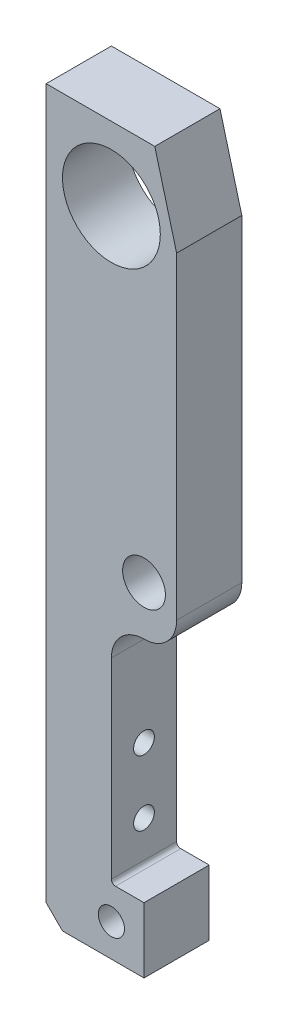
from build123d import *

# Parameters (mm, degrees)
SKETCH1_W                        = 25.4
SKETCH1_H                        = 141.2875
EXTRUDE1_DEPTH                   = 6.35
CUT_EXTRUDE1_REACH               = 74.891
SKETCH2_R                        = 9.525
CUT_EXTRUDE2_REACH               = 74.891
CHAMFER1_SIZE                    = 15.875
CHAMFER1_SIZE2                   = 4.25369343
F_21_64_0_32813_DIAMETER_HOLE1_D = 8.334502
F_1_4_20_TAPPED_HOLE1_D          = 5.1054
F_10_32_TAPPED_HOLE1_D           = 4.0386
F_10_32_TAPPED_HOLE1_DEPTH       = 13.716
F_10_32_TAPPED_HOLE1_TIP         = 1.213317848
FILLET1_R                        = 6.35
CHAMFER2_SIZE                    = 3.175


with BuildPart() as part:
    # Sketch1 → Extrude1 (new, symmetric)
    with BuildSketch(Plane.XY):
        Rectangle(SKETCH1_W, SKETCH1_H)
    extrude(amount=EXTRUDE1_DEPTH, both=True)

    # Sketch2 → Cut-Extrude1 (cut, up to next)
    with BuildSketch(Plane.XY.offset(6.35), mode=Mode.PRIVATE) as cut_extrude1_sk1:
        with Locations((0, 56.35625)):
            Circle(SKETCH2_R)
    cut_extrude1_tool1 = extrude(cut_extrude1_sk1.sketch, amount=-CUT_EXTRUDE1_REACH, mode=Mode.PRIVATE) & part.part
    add(cut_extrude1_tool1.solids().sort_by_distance((0, 56.35625, 6.35))[0], mode=Mode.SUBTRACT)

    # Sketch3 → Cut-Extrude2 (cut, up to next)
    with BuildSketch(Plane.XY.offset(6.35), mode=Mode.PRIVATE) as cut_extrude2_sk1:
        with BuildLine():
            Line((6.35, -57.94375), (0.79375, -57.94375))
            ThreePointArc((0.79375, -57.94375), (0.232483992, -57.711266008), (0, -57.15))
            Line((0, -57.15), (0, -19.84375))
            ThreePointArc((0, -19.84375), (1.859871939, -15.353621939), (6.35, -13.49375))
            Line((6.35, -13.49375), (12.7, -13.49375))
            Line((12.7, -13.49375), (12.7, -70.64375))
            Line((12.7, -70.64375), (6.35, -70.64375))
            Line((6.35, -70.64375), (6.35, -57.94375))
        make_face()
    cut_extrude2_tool1 = extrude(cut_extrude2_sk1.sketch, amount=-CUT_EXTRUDE2_REACH, mode=Mode.PRIVATE) & part.part
    add(cut_extrude2_tool1.solids().sort_by_distance((6.820727, -39.618194, 6.35))[0], mode=Mode.SUBTRACT)

    # Chamfer1
    chamfer1_edges = [part.edges().sort_by_distance(p)[0] for p in [
        (12.7, 70.64375, 0),
    ]]
    chamfer1_side = [part.faces().sort_by_distance(p)[0] for p in [
        (12.7, 28.575, 0),
    ]]
    chamfer(chamfer1_edges, length=CHAMFER1_SIZE, length2=CHAMFER1_SIZE2, reference=chamfer1_side[0])

    # 21/64 (0.32813) Diameter Hole1 (through all)
    with Locations(Plane.XY.offset(6.35)):
        with Locations((6.35, -3.96875)):
            Hole(F_21_64_0_32813_DIAMETER_HOLE1_D / 2)

    # 1/4-20 Tapped Hole1 (through all)
    with Locations(Plane.XY.offset(6.35)):
        with Locations((0, -64.29375)):
            Hole(F_1_4_20_TAPPED_HOLE1_D / 2)

    # #10-32 Tapped Hole1
    with Locations(Plane.ZY.offset(12.7)):
        with Locations((0, -50.00625), (0, -37.30625)):
            Hole(F_10_32_TAPPED_HOLE1_D / 2, depth=F_10_32_TAPPED_HOLE1_DEPTH)
            with Locations((0, 0, -(F_10_32_TAPPED_HOLE1_DEPTH + F_10_32_TAPPED_HOLE1_TIP / 2))):  # 118° drill point
                Cone(0, F_10_32_TAPPED_HOLE1_D / 2, F_10_32_TAPPED_HOLE1_TIP, mode=Mode.SUBTRACT)

    # Fillet1
    fillet1_edges = [part.edges().sort_by_distance(p)[0] for p in [
        (12.7, -13.49375, 0),
    ]]
    fillet(fillet1_edges, radius=FILLET1_R - 0.0001)  # a hair under: the kernel refuses the full size

    # Chamfer2
    chamfer2_edges = [part.edges().sort_by_distance(p)[0] for p in [
        (-12.7, -70.64375, 0),
    ]]
    chamfer(chamfer2_edges, length=CHAMFER2_SIZE)


solid = part.part
